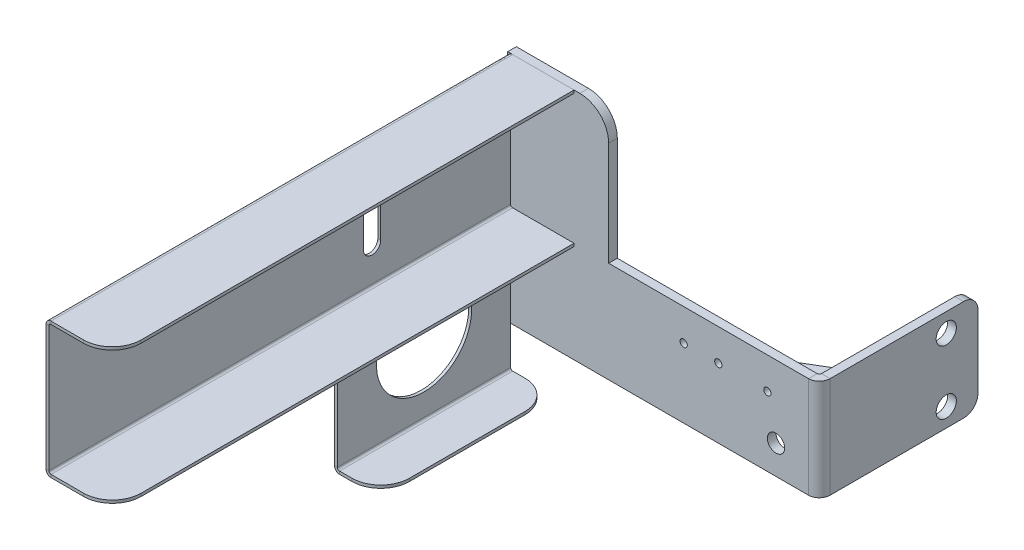
from build123d import *

# Parameters (mm, degrees)
SM_BASE_FLANGE_1_DEPTH           = 3
SM_EDGE_FLANGE_1_STRIP_W         = 13.4732
SM_EDGE_FLANGE_1_STRIP_H         = 3
SM_EDGE_FLANGE_1_STRIP_CUT_DEPTH = 35
SM_EDGE_FLANGE_1_DEPTH           = 35
SM_BASE_FLANGE_2_DEPTH           = 160
CUT_EXTRUDE_3_DEPTH              = 10
EXTRUDE_START                    = -17.5
EXTRUDE_1_DEPTH                  = 1.5
FILLET_3_R                       = 10
SKETCH_15_R                      = 3.5
CUT_EXTRUDE_5_DEPTH              = 3
FILLET_4_R                       = 5
HOLE_WIZARD_M3_1_AT_2_COUNT      = 2
HOLE_WIZARD_M3_1_AT_2_PITCH      = 12
HOLE_WIZARD_M3_1_AT_3_COUNT      = 2
HOLE_WIZARD_M3_1_AT_3_PITCH      = 29
SKETCH_18_R                      = 3
CUT_EXTRUDE_6_DEPTH              = 3
SKETCH_20_W                      = 1
SKETCH_20_H                      = 50
SM_BASE_FLANGE_3_DEPTH           = 60
SM_EDGE_FLANGE_2_STRIP_W         = 5.4732
SM_EDGE_FLANGE_2_STRIP_H         = 1
SM_EDGE_FLANGE_2_STRIP_CUT_DEPTH = 60
SM_EDGE_FLANGE_2_DEPTH           = 60
SKETCH_28_R                      = 16.5
CUT_EXTRUDE_7_DEPTH              = 10
FILLET_5_R                       = 10
FILLET_6_R                       = 10


# Sheet-metal steps are written as plain solids
with BuildPart() as part:
    # Sketch 1 → 基体-法兰1 (new body)
    with BuildSketch(Plane.XY):
        Polygon((0, 0), (-108, 0), (-108, 81), (-73, 81), (-73, 35), (0, 35), align=None)
    extrude(amount=-SM_BASE_FLANGE_1_DEPTH)

    # 边线-法兰1 strip (across the edge) → 边线-法兰1 strip cut (cut)
    with BuildSketch(Plane(origin=(0, 35, -3), x_dir=(-1, 0, 0), z_dir=(0, -1, 0))):
        with Locations((-3, -1.5)):
            Rectangle(SM_EDGE_FLANGE_1_STRIP_W, SM_EDGE_FLANGE_1_STRIP_H)
    extrude(amount=SM_EDGE_FLANGE_1_STRIP_CUT_DEPTH, mode=Mode.SUBTRACT)

    # 边线-法兰1 section (across the edge) → 边线-法兰1 (add)
    with BuildSketch(Plane(origin=(0, 35, -3), x_dir=(-1, 0, 0), z_dir=(0, -1, 0))):
        with BuildLine():
            Line((0, 0.7366), (0, 52))
            Line((0, 52), (3, 52))
            Line((3, 52), (3, 0.7366))
            ThreePointArc((3, 0.7366), (3.215745145, 0.215745145), (3.7366, 0))
            Line((3.7366, 0), (3.7366, -3))
            ThreePointArc((3.7366, -3), (1.094424801, -1.905575199), (0, 0.7366))
        make_face()
    extrude(amount=SM_EDGE_FLANGE_1_DEPTH)

    # 草图14 → 凸台-拉伸1 (add, symmetric)
    with BuildSketch(Plane.XZ.offset(EXTRUDE_START)):
        with BuildLine():
            Line((-3, -3.7366), (-3, -33))
            Line((-3, -33), (-53, -3))
            Line((-53, -3), (-3.7366, -3))
            ThreePointArc((-3.7366, -3), (-3.215745145, -3.215745145), (-3, -3.7366))
        make_face()
    extrude(amount=EXTRUDE_1_DEPTH, both=True)

    # 草图15 → 切除-拉伸5 (cut)
    with BuildSketch(Plane(origin=(0, 0, 0), x_dir=(0, 0, -1), z_dir=(1, 0, 0))):
        with Locations((44, 6.5)):
            Circle(SKETCH_15_R)
        with Locations((44, 28.5)):
            Circle(SKETCH_15_R)
    extrude(amount=-CUT_EXTRUDE_5_DEPTH, mode=Mode.SUBTRACT)

    # 圆角4
    fillet_4_edges = [part.edges().sort_by_distance(p)[0] for p in [
        (-1.5, 35, -55),
        (-1.5, 0, -55),
    ]]
    fillet(fillet_4_edges, radius=FILLET_4_R)

    # 草图16 → M3 螺纹孔1 (revolve, cut)
    with BuildSketch(Plane(origin=(-47, 24, 0), x_dir=(0, -1, 0), z_dir=(1, 0, 0))):
        Polygon((0, 0), (0, 8.251075774), (1.25, 7.5), (1.25, 0), align=None)
    hole_wizard_m3_1 = revolve(axis=Axis((-47, 24, 6.35), (0, 0, -1)), mode=Mode.SUBTRACT)

    # M3 螺纹孔1 at 2: M3 螺纹孔1 ×2
    with Locations(*[(i * HOLE_WIZARD_M3_1_AT_2_PITCH, 0, 0) for i in range(1, HOLE_WIZARD_M3_1_AT_2_COUNT)]):
        add(hole_wizard_m3_1, mode=Mode.SUBTRACT)

    # M3 螺纹孔1 at 3: M3 螺纹孔1 ×2
    with Locations(*[(i * HOLE_WIZARD_M3_1_AT_3_PITCH, 0, 0) for i in range(1, HOLE_WIZARD_M3_1_AT_3_COUNT)]):
        add(hole_wizard_m3_1, mode=Mode.SUBTRACT)

    # 草图18 → 切除-拉伸6 (cut)
    with BuildSketch(Plane.XY):
        with Locations((-15, 10)):
            Circle(SKETCH_18_R)
    extrude(amount=-CUT_EXTRUDE_6_DEPTH, mode=Mode.SUBTRACT)

    # 圆角6
    fillet_6_edges = [part.edges().sort_by_distance(p)[0] for p in [
        (-73, 81, -1.5),
    ]]
    fillet(fillet_6_edges, radius=FILLET_6_R)


with BuildPart() as body_2:
    # 草图6 → 基体-法兰2 (new body)
    with BuildSketch(Plane.XY):
        with BuildLine():
            Line((-85, 81), (-106.2634, 81))
            ThreePointArc((-106.2634, 81), (-107.491361636, 80.491361636), (-108, 79.2634))
            Line((-108, 79.2634), (-108, 35.7366))
            ThreePointArc((-108, 35.7366), (-107.491361636, 34.508638364), (-106.2634, 34))
            Line((-106.2634, 34), (-85, 34))
            Line((-85, 34), (-85, 35))
            Line((-85, 35), (-106.2634, 35))
            ThreePointArc((-106.2634, 35), (-106.784254855, 35.215745145), (-107, 35.7366))
            Line((-107, 35.7366), (-107, 79.2634))
            ThreePointArc((-107, 79.2634), (-106.784254855, 79.784254855), (-106.2634, 80))
            Line((-106.2634, 80), (-85, 80))
            Line((-85, 80), (-85, 81))
        make_face()
    extrude(amount=SM_BASE_FLANGE_2_DEPTH)

    # 草图12 → 切除-拉伸3 (cut)
    with BuildSketch(Plane.ZY.offset(108)):
        with BuildLine():
            Line((51, 68.5), (51, 47.5))
            ThreePointArc((51, 47.5), (48, 44.5), (45, 47.5))
            Line((45, 47.5), (45, 68.5))
            ThreePointArc((45, 68.5), (48, 71.5), (51, 68.5))
        make_face()
    extrude(amount=-CUT_EXTRUDE_3_DEPTH, mode=Mode.SUBTRACT)

    # 圆角3
    fillet_3_edges = [body_2.edges().sort_by_distance(p)[0] for p in [
        (-85, 80.5, 160),
        (-85, 34.5, 160),
    ]]
    fillet(fillet_3_edges, radius=FILLET_3_R)


with BuildPart() as body_3:
    # 草图20 → 基体-法兰3 (new body)
    with BuildSketch(Plane.XY):
        with Locations((-107.5, 10)):
            Rectangle(SKETCH_20_W, SKETCH_20_H)
    extrude(amount=SM_BASE_FLANGE_3_DEPTH)

    # 边线-法兰2 strip (across the edge) → 边线-法兰2 strip cut (cut)
    with BuildSketch(Plane(origin=(-107, -15, 60), x_dir=(0, 1, 0), z_dir=(0, 0, -1))):
        with Locations((-1, -0.5)):
            Rectangle(SM_EDGE_FLANGE_2_STRIP_W, SM_EDGE_FLANGE_2_STRIP_H)
    extrude(amount=SM_EDGE_FLANGE_2_STRIP_CUT_DEPTH, mode=Mode.SUBTRACT)

    # 边线-法兰2 section (across the edge) → 边线-法兰2 (add)
    with BuildSketch(Plane(origin=(-107, -15, 60), x_dir=(0, 1, 0), z_dir=(0, 0, -1))):
        with BuildLine():
            Line((0, 0.7366), (0, 15))
            Line((0, 15), (1, 15))
            Line((1, 15), (1, 0.7366))
            ThreePointArc((1, 0.7366), (1.215745145, 0.215745145), (1.7366, 0))
            Line((1.7366, 0), (1.7366, -1))
            ThreePointArc((1.7366, -1), (0.508638364, -0.491361636), (0, 0.7366))
        make_face()
    extrude(amount=SM_EDGE_FLANGE_2_DEPTH)

    # 草图28 → 切除-拉伸7 (cut)
    with BuildSketch(Plane(origin=(-107, 0, 0), x_dir=(0, 0, -1), z_dir=(1, 0, 0))):
        with Locations((-30, 10.8683)):
            Circle(SKETCH_28_R)
    extrude(amount=-CUT_EXTRUDE_7_DEPTH, mode=Mode.SUBTRACT)

    # 圆角5
    fillet_5_edges = [body_3.edges().sort_by_distance(p)[0] for p in [
        (-92, -14.5, 60),
        (-92, -14.5, 0),
    ]]
    fillet(fillet_5_edges, radius=FILLET_5_R)


solid = Compound([part.part, body_2.part, body_3.part])
